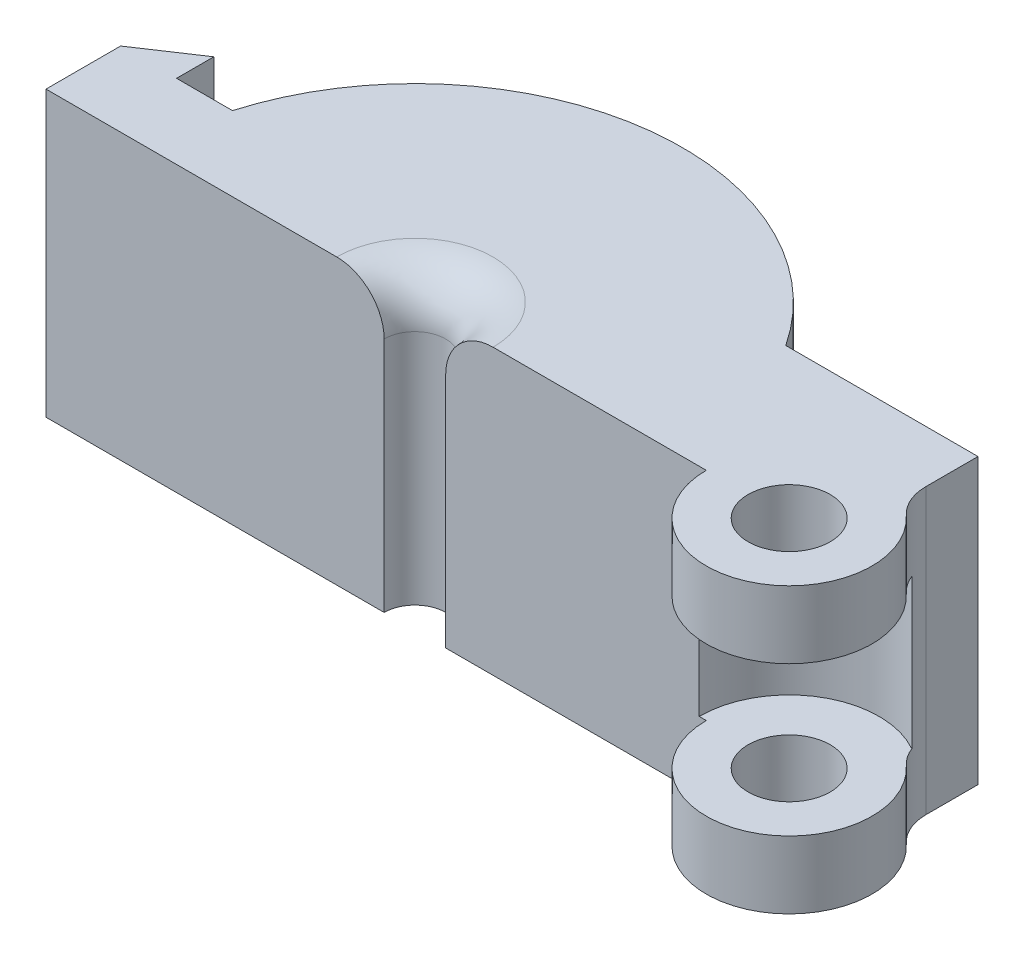
from build123d import *

# Parameters (mm, degrees)
SKETCH1_R           = 2.2
BOSS_EXTRUDE1_DEPTH = 15.24
SKETCH2_R           = 4.826
CUT_EXTRUDE1_DEPTH  = 4.0005
FILLET2_R           = 2.54
FILLET3_R           = 2.54


with BuildPart() as part:
    # Sketch1 → Boss-Extrude1 (new body)
    with BuildSketch(Plane(origin=(0, 0, 0), x_dir=(1, 0, 0), z_dir=(0, 1, 0))):
        with BuildLine():
            Line((-19.782278513, 0), (-13.782278513, 0))
            Line((-13.782278513, 0), (-1.651, 0))
            ThreePointArc((-1.651, 0), (0, 1.651), (1.651, 0))
            Line((1.651, 0), (15.625, 0))
            ThreePointArc((15.625, 0), (22.30372167, -3.84298224), (22.27, 3.862385921))
            Line((22.27, 3.862385921), (22.27, 7.926385921))
            Line((22.27, 7.926385921), (11.963427905, 7.926385921))
            ThreePointArc((11.963427905, 7.926385921), (6.7896847, 12.64323466), (0, 14.351))
            ThreePointArc((0, 14.351), (-8.618213301, 11.475086078), (-13.782278513, 4))
            Line((-13.782278513, 4), (-16.782278513, 4))
            Line((-16.782278513, 4), (-16.782278513, 6))
            Line((-16.782278513, 6), (-19.782278513, 4))
            Line((-19.782278513, 4), (-19.782278513, 0))
        make_face()
        with Locations(Location((20.07, 0, 0), (0, 0, 90))):
            Circle(SKETCH1_R, mode=Mode.SUBTRACT)
    extrude(amount=BOSS_EXTRUDE1_DEPTH)

    # Sketch2 → Cut-Extrude1 (cut, symmetric)
    with BuildSketch(Plane(origin=(0, 7.62, 0), x_dir=(1, 0, 0), z_dir=(0, 1, 0))):
        with Locations((20.07, 0)):
            Circle(SKETCH2_R)
    extrude(amount=CUT_EXTRUDE1_DEPTH, both=True, mode=Mode.SUBTRACT)

    # Fillet2
    fillet2_edges = [part.edges().sort_by_distance(p)[0] for p in [
        (0, 15.24, -1.651),
    ]]
    fillet(fillet2_edges, radius=FILLET2_R)

    # Fillet3
    # the kernel refuses this fillet: 2.54 mm, written as the material it adds along each edge
    with BuildSketch(Plane(origin=(22.27, 4.011467753, -3.862385921), x_dir=(0.8069614715901079, 0, 0.5906040834341796), z_dir=(0, 1, 0))) as fillet3_piece_1_section:
        with BuildLine():
            CenterArc((1.300694552, 2.523500349), FILLET3_R, 216.19988752, 47.265895784)
            Line((-0.748987586, 1.023365977), (-0.789981229, 0.993363289))
            Line((-0.789981229, 0.993363289), (-0.040993643, -0.030002687))
            Line((-0.040993643, -0.030002687), (0.005780865, -0.050470007))
            ThreePointArc((0.005780865, -0.050470007), (0.505825659, -0.02192561), (1.005870453, -0.050470007))
            Line((1.005870453, -0.050470007), (1.011651318, 0))
        make_face()
    fillet3_piece_1 = extrude(amount=11.228532247, mode=Mode.PRIVATE)
    fillet3_piece_1 = split(fillet3_piece_1, bisect_by=Plane(origin=(22.284641862, 11.6205, -4.588750924), z_dir=(0, -1, 0)), keep=Keep.TOP, mode=Mode.PRIVATE)
    fillet3_piece_1 = fillet3_piece_1 - Plane(origin=(20.07, 7.815983876, 0), x_dir=(1, 0, 0), z_dir=(0, 1, 0)) * Cylinder(4.826, 27, mode=Mode.PRIVATE)
    add(fillet3_piece_1)
    with BuildSketch(Plane(origin=(22.27, 11.6205, -3.862385921), x_dir=(0.8069614715901079, 0, 0.5906040834341796), z_dir=(0, 1, 0))) as fillet3_piece_2_section:
        with BuildLine():
            CenterArc((1.300694552, 2.523500349), FILLET3_R, 216.19988752, 47.265895784)
            Line((-0.748987586, 1.023365977), (-0.789981229, 0.993363289))
            Line((-0.789981229, 0.993363289), (-0.040993643, -0.030002687))
            Line((-0.040993643, -0.030002687), (0.005780865, -0.050470007))
            ThreePointArc((0.005780865, -0.050470007), (0.505825659, -0.02192561), (1.005870453, -0.050470007))
            Line((1.005870453, -0.050470007), (1.011651318, 0))
        make_face()
    fillet3_piece_2 = extrude(amount=3.6195, mode=Mode.PRIVATE)
    fillet3_piece_2 = fillet3_piece_2 & Plane(origin=(20.07, 13.43025, 0), x_dir=(1, 0, 0), z_dir=(0, 1, 0)) * Cylinder(4.826, 12, mode=Mode.PRIVATE)
    add(fillet3_piece_2)
    with BuildSketch(Plane(origin=(22.27, 11.6205, -3.862385921), x_dir=(0.8069614715901079, 0, 0.5906040834341796), z_dir=(0, 1, 0))) as fillet3_piece_3_section:
        with BuildLine():
            CenterArc((1.300694552, 2.523500349), FILLET3_R, 216.19988752, 47.265895784)
            Line((-0.748987586, 1.023365977), (-0.789981229, 0.993363289))
            Line((-0.789981229, 0.993363289), (-0.040993643, -0.030002687))
            Line((-0.040993643, -0.030002687), (0.005780865, -0.050470007))
            ThreePointArc((0.005780865, -0.050470007), (0.505825659, -0.02192561), (1.005870453, -0.050470007))
            Line((1.005870453, -0.050470007), (1.011651318, 0))
        make_face()
    fillet3_piece_3 = extrude(amount=3.6195, mode=Mode.PRIVATE)
    fillet3_piece_3 = fillet3_piece_3 - Plane(origin=(20.07, 13.43025, 0), x_dir=(1, 0, 0), z_dir=(0, 1, 0)) * Cylinder(4.826, 12, mode=Mode.PRIVATE)
    add(fillet3_piece_3)
    with BuildSketch(Plane(origin=(22.27, 0, -3.862385921), x_dir=(0, 0, -1), z_dir=(0, 1, 0))) as fillet3_piece_4_section:
        with BuildLine():
            CenterArc((1.268172041, -2.54), FILLET3_R, 90, 47.265895784)
            Line((-0.597485399, -0.816363636), (-0.634798548, -0.781890909))
            ThreePointArc((-0.634798548, -0.781890909), (-0.316435822, -0.395232463), (-0.044141553, 0.025142857))
            Line((-0.044141553, 0.025142857), (0, 0.0508))
            Line((0, 0.0508), (1.268172041, 0.0508))
            Line((1.268172041, 0.0508), (1.268172041, 0))
        make_face()
    fillet3_piece_4 = extrude(amount=3.6195, mode=Mode.PRIVATE)
    fillet3_piece_4 = fillet3_piece_4 - Plane(origin=(20.07, 1.80975, 0), x_dir=(1, 0, 0), z_dir=(0, 1, 0)) * Cylinder(4.826, 13, mode=Mode.PRIVATE)
    add(fillet3_piece_4)
    with BuildSketch(Plane(origin=(22.27, 0, -3.862385921), x_dir=(0, 0, -1), z_dir=(0, 1, 0))) as fillet3_piece_5_section:
        with BuildLine():
            CenterArc((1.268172041, -2.54), FILLET3_R, 90, 47.265895784)
            Line((-0.597485399, -0.816363636), (-0.634798548, -0.781890909))
            ThreePointArc((-0.634798548, -0.781890909), (-0.316435822, -0.395232463), (-0.044141553, 0.025142857))
            Line((-0.044141553, 0.025142857), (0, 0.0508))
            Line((0, 0.0508), (1.268172041, 0.0508))
            Line((1.268172041, 0.0508), (1.268172041, 0))
        make_face()
    fillet3_piece_5 = extrude(amount=3.6195, mode=Mode.PRIVATE)
    fillet3_piece_5 = fillet3_piece_5 & Plane(origin=(20.07, 1.80975, 0), x_dir=(1, 0, 0), z_dir=(0, 1, 0)) * Cylinder(4.826, 13, mode=Mode.PRIVATE)
    add(fillet3_piece_5)
    with BuildSketch(Plane(origin=(22.27, 0, -3.862385921), x_dir=(0, 0, -1), z_dir=(0, 1, 0))) as fillet3_piece_6_section:
        with BuildLine():
            CenterArc((1.268172041, -2.54), FILLET3_R, 90, 47.265895784)
            Line((-0.597485399, -0.816363636), (-0.634798548, -0.781890909))
            ThreePointArc((-0.634798548, -0.781890909), (-0.316435822, -0.395232463), (-0.044141553, 0.025142857))
            Line((-0.044141553, 0.025142857), (0, 0.0508))
            Line((0, 0.0508), (1.268172041, 0.0508))
            Line((1.268172041, 0.0508), (1.268172041, 0))
        make_face()
    fillet3_piece_6 = extrude(amount=11.228532247, mode=Mode.PRIVATE)
    fillet3_piece_6 = fillet3_piece_6 - Plane(origin=(20.07, 7.424016124, 0), x_dir=(1, 0, 0), z_dir=(0, 1, 0)) * Cylinder(4.826, 28, mode=Mode.PRIVATE)
    fillet3_piece_6 = split(fillet3_piece_6, bisect_by=Plane(origin=(22.284641862, 3.6195, -4.588750924), z_dir=(0, 1, 0)), keep=Keep.TOP, mode=Mode.PRIVATE)
    add(fillet3_piece_6)


solid = part.part
